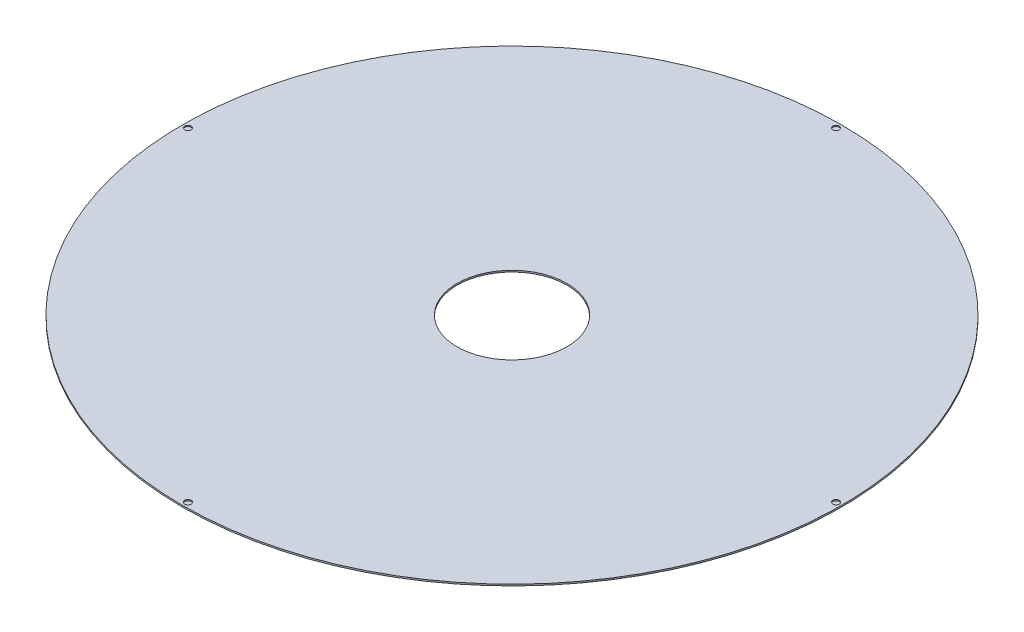
from build123d import *

# Parameters (mm, degrees)
SKETCH1_W          = 1250
SKETCH1_H          = 7
SKETCH2_R          = 15
CUT_EXTRUDE1_DEPTH = 5


with BuildPart() as part:
    # Sketch1 → Revolve1 (revolve)
    with BuildSketch(Plane.XY):
        with Locations((875, 0)):
            Rectangle(SKETCH1_W, SKETCH1_H)
    revolve(axis=Axis((0, 0, 0), (0, 1, 0)))

    # Sketch2 → Cut-Extrude1 (cut)
    with BuildSketch(Plane(origin=(0, 3.5, 0), x_dir=(1, 0, 0), z_dir=(0, 1, 0))):
        with Locations((0, 1475)):
            Circle(SKETCH2_R)
        with Locations((-1475, 0)):
            Circle(SKETCH2_R)
        with Locations((1475, 0)):
            Circle(SKETCH2_R)
        with Locations((0, -1475)):
            Circle(SKETCH2_R)
    extrude(amount=-CUT_EXTRUDE1_DEPTH, mode=Mode.SUBTRACT)


solid = part.part
